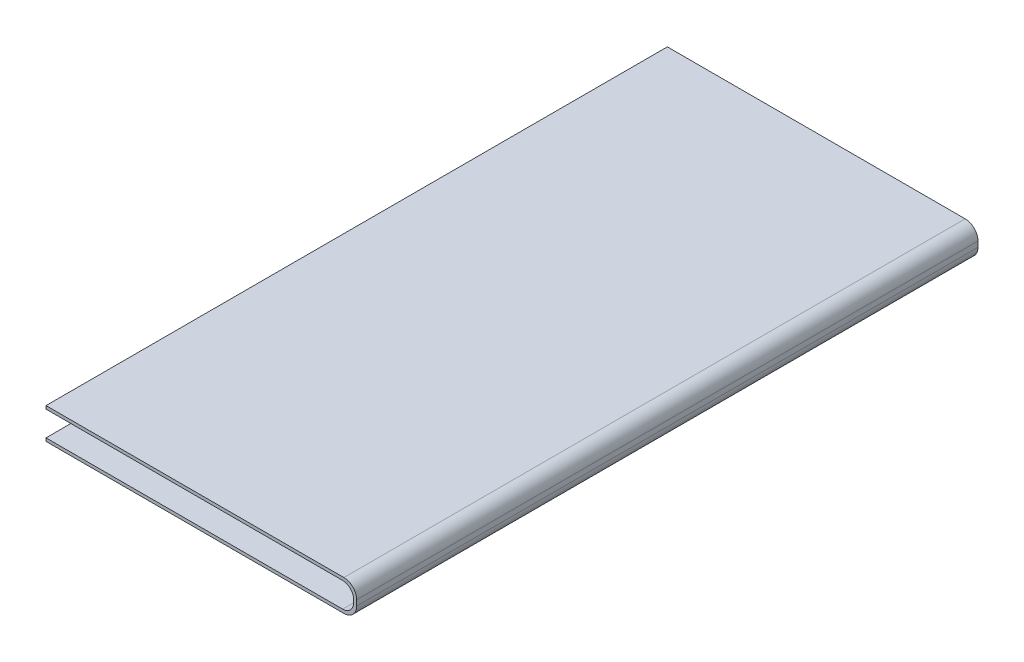
from build123d import *

# Parameters (mm, degrees)
EXTRUDE_1_DEPTH = 10


with BuildPart() as part:
    # Эскиз1 → Бобышка-Вытянуть1 (new, symmetric)
    with BuildSketch(Plane.XY):
        with BuildLine():
            Line((14.5, -1.5), (24.0875, -1.5))
            ThreePointArc((24.0875, -1.5), (24.379181547, -1.620818453), (24.5, -1.9125))
            Line((24.5, -1.9125), (24.5, -2.0875))
            ThreePointArc((24.5, -2.0875), (24.379181547, -2.379181547), (24.0875, -2.5))
            Line((24.0875, -2.5), (14.5, -2.5))
            Line((14.5, -2.5), (14.5, -2.4))
            Line((14.5, -2.4), (24.05, -2.4))
            ThreePointArc((24.05, -2.4), (24.297487373, -2.297487373), (24.4, -2.05))
            Line((24.4, -2.05), (24.4, -1.95))
            ThreePointArc((24.4, -1.95), (24.297487373, -1.702512627), (24.05, -1.6))
            Line((24.05, -1.6), (14.5, -1.6))
            Line((14.5, -1.6), (14.5, -1.5))
        make_face()
    extrude(amount=EXTRUDE_1_DEPTH, both=True)


solid = part.part
